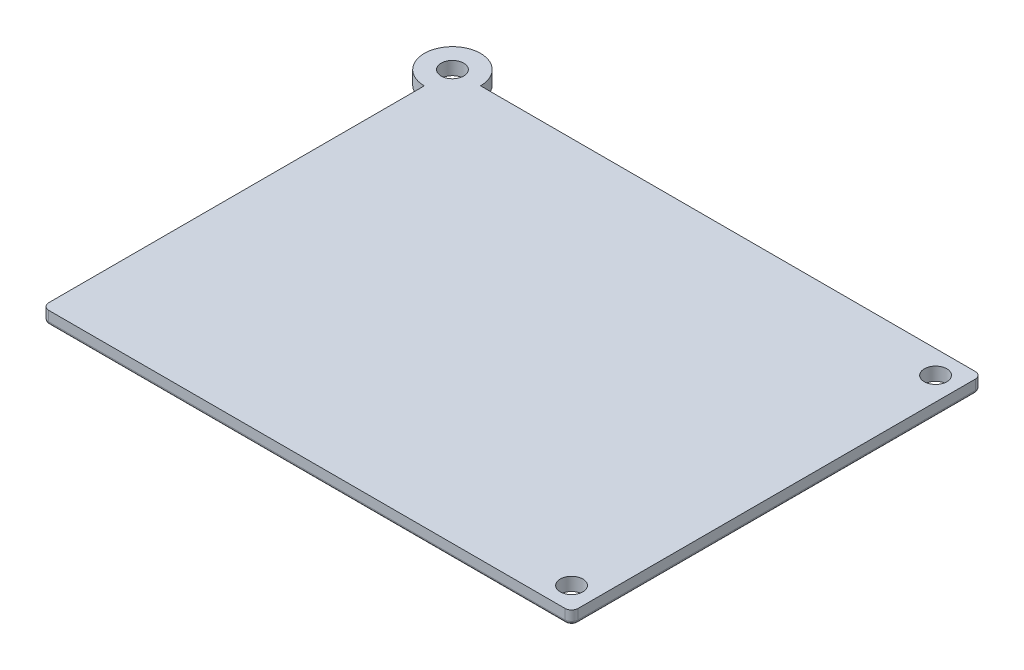
from build123d import *

# Parameters (mm, degrees)
MAIN_BODY_DEPTH                          = 2
CORNERS_R                                = 1
EDGE_2_R                                 = 0.5
LID_HOLES_DEPTH                          = 57.609407489
LID_HOLES_DEPTH_BACK                     = 57.609407489
SKETCH7_R                                = 1.7
SKETCH4_R                                = 2.325
BOSS_EXTRUDE3_DEPTH                      = 1.6
FILLET3_R                                = 0.05
LPATTERN5_COUNT                          = 4
LPATTERN5_PITCH                          = 8
FILLET3_OF_LPATTERN5_R                   = 0.05
SKETCH9_R                                = 2.325
LEGO_PEGS_DEPTH                          = 1.6
SOFTEN_3D_PRINTED_CORNERS_R              = 0.05
LPATTERN6_COUNT                          = 4
LPATTERN6_PITCH                          = 8
SOFTEN_3D_PRINTED_CORNERS_OF_LPATTERN6_R = 0.05


with BuildPart() as part:
    # Sketch1 → Main Body (new body)
    with BuildSketch(Plane(origin=(0, 0, 0), x_dir=(1, 0, 0), z_dir=(0, 1, 0))):
        with BuildLine():
            Line((-40, -31), (40, -31))
            Line((40, -31), (40, 31))
            Line((40, 31), (-35.75, 31))
            ThreePointArc((-35.75, 31), (-43.00520382, 34.00520382), (-40, 26.75))
            Line((-40, 26.75), (-40, -31))
        make_face()
    extrude(amount=MAIN_BODY_DEPTH)

    # Corners
    corners_edges = [part.edges().sort_by_distance(p)[0] for p in [
        (-40, 1, 31),
        (40, 1, -31),
        (40, 1, 31),
    ]]
    fillet(corners_edges, radius=CORNERS_R)

    # Edge 2
    edge_2_edges = [part.edges().sort_by_distance(p)[0] for p in [
        (-39.707106781, 0, 30.707106781),
        (39.707106781, 0, -30.707106781),
        (39.707106781, 0, 30.707106781),
        (-40, 0, 1.625),
        (1.625, 0, -31),
        (40, 0, 0),
        (0, 0, 31),
    ]]
    fillet(edge_2_edges, radius=EDGE_2_R)

    # Sketch7 → Lid Holes (cut, two sides: drawn at the far end of the back side and taken through both)
    with BuildSketch(Plane(origin=(0, 0, 0), x_dir=(-1, 0, 0), z_dir=(0, -1, 0)).offset(-LID_HOLES_DEPTH_BACK)):
        with Locations((40, 31)):
            Circle(SKETCH7_R)
        with Locations((-36.5, -27.5)):
            Circle(SKETCH7_R)
        with Locations((-36.5, 27.5)):
            Circle(SKETCH7_R)
    extrude(amount=LID_HOLES_DEPTH + LID_HOLES_DEPTH_BACK, mode=Mode.SUBTRACT)

    # Sketch4 → Boss-Extrude3 (add)
    with BuildSketch(Plane(origin=(0, 0, 0), x_dir=(-1, 0, 0), z_dir=(0, -1, 0))):
        with Locations((-30, 24)):
            Circle(SKETCH4_R)
        with Locations((-30, 16)):
            Circle(SKETCH4_R)
    boss_extrude3 = extrude(amount=BOSS_EXTRUDE3_DEPTH)

    # Fillet3
    fillet3_edges = [part.edges().sort_by_distance(p)[0] for p in [
        (32.325, -1.6, -24),
    ]]
    fillet(fillet3_edges, radius=FILLET3_R)

    # LPattern5: Boss-Extrude3 ×4
    with Locations(*[(-i * LPATTERN5_PITCH, 0, 0) for i in range(1, LPATTERN5_COUNT)]):
        add(boss_extrude3)

    # Fillet3 of LPattern5
    fillet3_of_lpattern5_edges = [part.edges().sort_by_distance(p)[0] for p in [
        (24.325, -1.6, -24),
        (16.325, -1.6, -24),
        (8.325, -1.6, -24),
    ]]
    fillet(fillet3_of_lpattern5_edges, radius=FILLET3_OF_LPATTERN5_R)

    # Sketch9 → LEGO Pegs (add)
    with BuildSketch(Plane.XZ):
        with Locations((31.570029353, 17.195868514)):
            Circle(SKETCH9_R)
        with Locations((24.429970647, 20.804131486)):
            Circle(SKETCH9_R)
    lego_pegs = extrude(amount=LEGO_PEGS_DEPTH)

    # Soften 3D printed corners
    soften_3d_printed_corners_edges = [part.edges().sort_by_distance(p)[0] for p in [
        (22.104970647, -1.6, 20.804131486),
        (29.245029353, -1.6, 17.195868514),
    ]]
    fillet(soften_3d_printed_corners_edges, radius=SOFTEN_3D_PRINTED_CORNERS_R)

    # LPattern6: LEGO Pegs ×4
    with Locations(*[Vector(-0.4510328715386793, 0, -0.8925073382284165) * (i * LPATTERN6_PITCH) for i in range(1, LPATTERN6_COUNT)]):
        add(lego_pegs)

    # Soften 3D printed corners of LPattern6
    soften_3d_printed_corners_of_lpattern6_edges = [part.edges().sort_by_distance(p)[0] for p in [
        (18.496707675, -1.6, 13.66407278),
        (25.636766381, -1.6, 10.055809808),
        (14.888444702, -1.6, 6.524014075),
        (22.028503408, -1.6, 2.915751102),
        (11.28018173, -1.6, -0.616044631),
        (18.420240436, -1.6, -4.224307604),
    ]]
    fillet(soften_3d_printed_corners_of_lpattern6_edges, radius=SOFTEN_3D_PRINTED_CORNERS_OF_LPATTERN6_R)


solid = part.part
